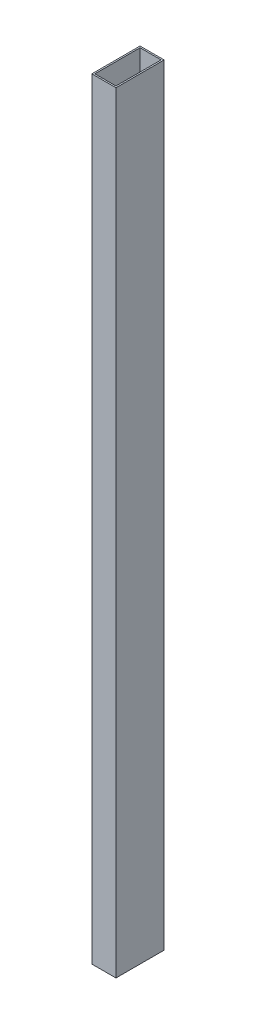
from build123d import *

# Parameters (mm, degrees)
SKETCH1_W           = 25.4
SKETCH1_H           = 50.8
SKETCH1_W_2         = 22.225
SKETCH1_H_2         = 47.625
EXTRUDE_THIN1_DEPTH = 812.8


with BuildPart() as part:
    # Sketch1 → Extrude-Thin1 (new body)
    with BuildSketch(Plane(origin=(0, 0, 0), x_dir=(1, 0, 0), z_dir=(0, 1, 0))):
        Rectangle(SKETCH1_W, SKETCH1_H)
        Rectangle(SKETCH1_W_2, SKETCH1_H_2, mode=Mode.SUBTRACT)
    extrude(amount=EXTRUDE_THIN1_DEPTH)


solid = part.part
